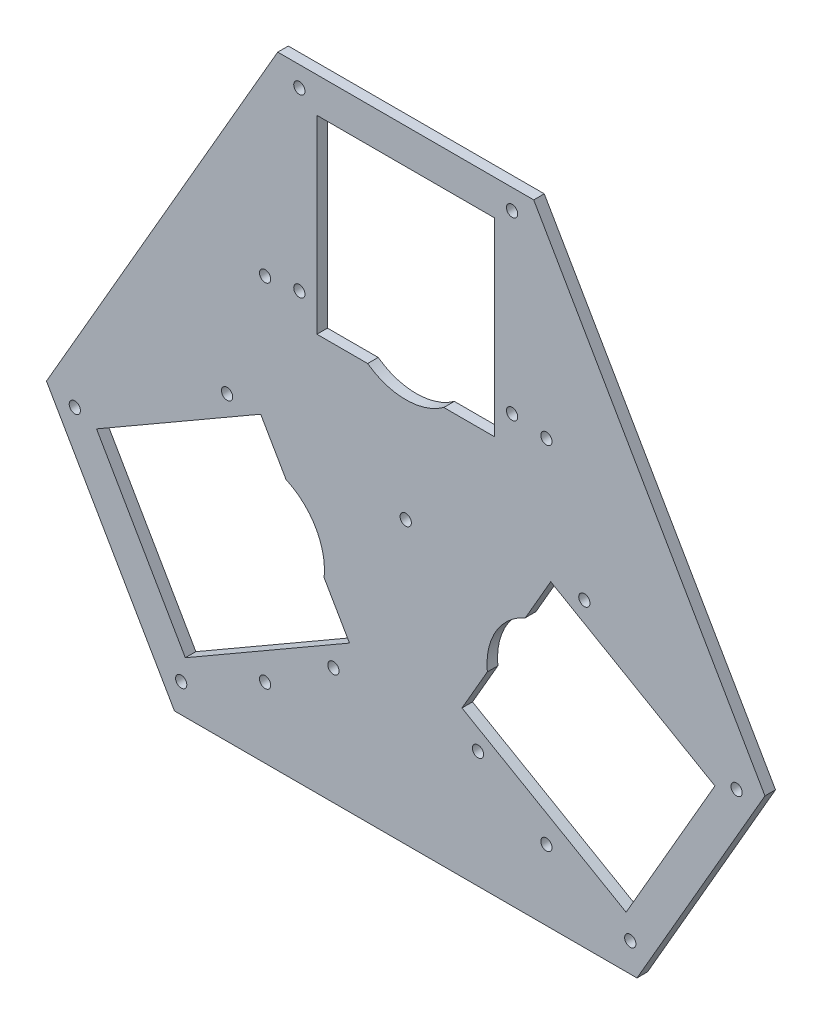
from build123d import *

# Parameters (mm, degrees)
SKETCH_1_R          = 1.6
SKETCH_1_W          = 50.5
SKETCH_1_H          = 53.910884284
EXTRUDE_1_DEPTH     = 3
CUT_EXTRUDE_1_DEPTH = 141.879738059


with BuildPart() as part:
    # ｽｹｯﾁ1 → ﾎﾞｽ - 押し出し1 (new body)
    with BuildSketch(Plane.XY):
        Polygon((36.39879245, 96.955442142), (-36.39879245, 96.955442142), (-102.165272155, -16.955442142), (-65.766479705, -80), (65.766479705, -80), (102.165272155, -16.955442142), align=None)
        with Locations((-63.852618114, -71.795017542)):
            Circle(SKETCH_1_R, mode=Mode.SUBTRACT)
        with Locations((-40, -60)):
            Circle(SKETCH_1_R, mode=Mode.SUBTRACT)
        with Locations((-20.551347925, -46.795017542)):
            Circle(SKETCH_1_R, mode=Mode.SUBTRACT)
        with Locations((-94.102618114, -19.400480613)):
            Circle(SKETCH_1_R, mode=Mode.SUBTRACT)
        Polygon((-15.992426562, -38.389420375), (-62.680621892, -65.344862517), (-87.930621892, -21.610579625), (-41.242426562, 5.344862517), align=None, mode=Mode.SUBTRACT)
        with Locations((-50.801347925, 5.599519387)):
            Circle(SKETCH_1_R, mode=Mode.SUBTRACT)
        Circle(SKETCH_1_R, mode=Mode.SUBTRACT)
        with Locations((40, -60)):
            Circle(SKETCH_1_R, mode=Mode.SUBTRACT)
        with Locations((20.551347925, -46.795017542)):
            Circle(SKETCH_1_R, mode=Mode.SUBTRACT)
        with Locations((63.852618114, -71.795017542)):
            Circle(SKETCH_1_R, mode=Mode.SUBTRACT)
        with Locations((50.801347925, 5.599519387)):
            Circle(SKETCH_1_R, mode=Mode.SUBTRACT)
        Polygon((41.242426562, 5.344862517), (87.930621892, -21.610579625), (62.680621892, -65.344862517), (15.992426562, -38.389420375), align=None, mode=Mode.SUBTRACT)
        with Locations((94.102618114, -19.400480613)):
            Circle(SKETCH_1_R, mode=Mode.SUBTRACT)
        with Locations((-40, 40)):
            Circle(SKETCH_1_R, mode=Mode.SUBTRACT)
        with Locations((-30.25, 41.195498156)):
            Circle(SKETCH_1_R, mode=Mode.SUBTRACT)
        with Locations((0, 60)):
            Rectangle(SKETCH_1_W, SKETCH_1_H, mode=Mode.SUBTRACT)
        with Locations((-30.25, 91.195498156)):
            Circle(SKETCH_1_R, mode=Mode.SUBTRACT)
        with Locations((30.25, 41.195498156)):
            Circle(SKETCH_1_R, mode=Mode.SUBTRACT)
        with Locations((40, 40)):
            Circle(SKETCH_1_R, mode=Mode.SUBTRACT)
        with Locations((30.25, 91.195498156)):
            Circle(SKETCH_1_R, mode=Mode.SUBTRACT)
    extrude(amount=EXTRUDE_1_DEPTH)

    # ｽｹｯﾁ2 → ｶｯﾄ - 押し出し1 (cut, through all)
    with BuildSketch(Plane.XY.offset(3)):
        with BuildLine():
            Line((-10.828203914, 33.044557858), (10.828203914, 33.044557858))
            ThreePointArc((10.828203914, 33.044557858), (0, 29.544557858), (-10.828203914, 33.044557858))
        make_face()
        with BuildLine():
            Line((34.031528519, -7.144779262), (23.203324605, -25.899778596))
            ThreePointArc((23.203324605, -25.899778596), (25.586337649, -14.772278929), (34.031528519, -7.144779262))
        make_face()
        with BuildLine():
            Line((-23.203324605, -25.899778596), (-34.031528519, -7.144779262))
            ThreePointArc((-34.031528519, -7.144779262), (-25.586337649, -14.772278929), (-23.203324605, -25.899778596))
        make_face()
    extrude(amount=-CUT_EXTRUDE_1_DEPTH, mode=Mode.SUBTRACT)


solid = part.part
